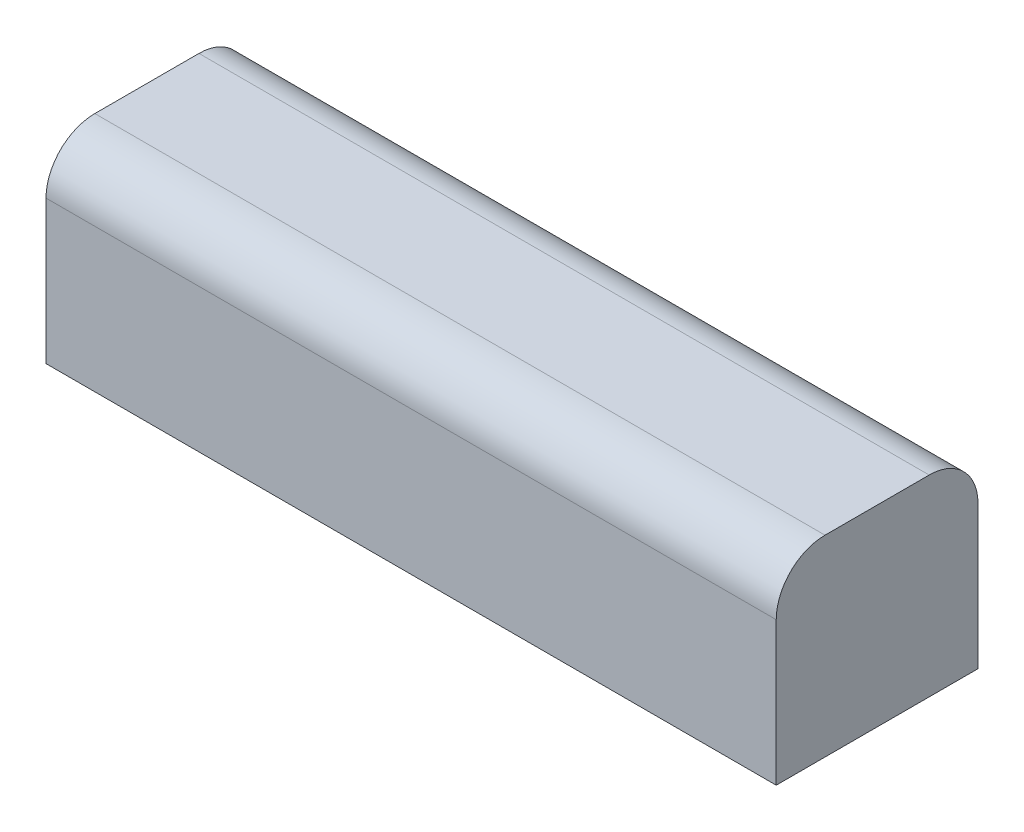
from build123d import *

# Parameters (mm, degrees)
SKETCH1_W           = 76
SKETCH1_H           = 21
BOSS_EXTRUDE1_DEPTH = 20
FILLET1_R           = 5.08


with BuildPart() as part:
    # Sketch1 → Boss-Extrude1 (new body)
    with BuildSketch(Plane(origin=(0, 0, 0), x_dir=(1, 0, 0), z_dir=(0, 1, 0))):
        Rectangle(SKETCH1_W, SKETCH1_H)
    extrude(amount=BOSS_EXTRUDE1_DEPTH)

    # Fillet1
    fillet1_edges = [part.edges().sort_by_distance(p)[0] for p in [
        (0, 20, -10.5),
        (0, 20, 10.5),
    ]]
    fillet(fillet1_edges, radius=FILLET1_R)


solid = part.part
